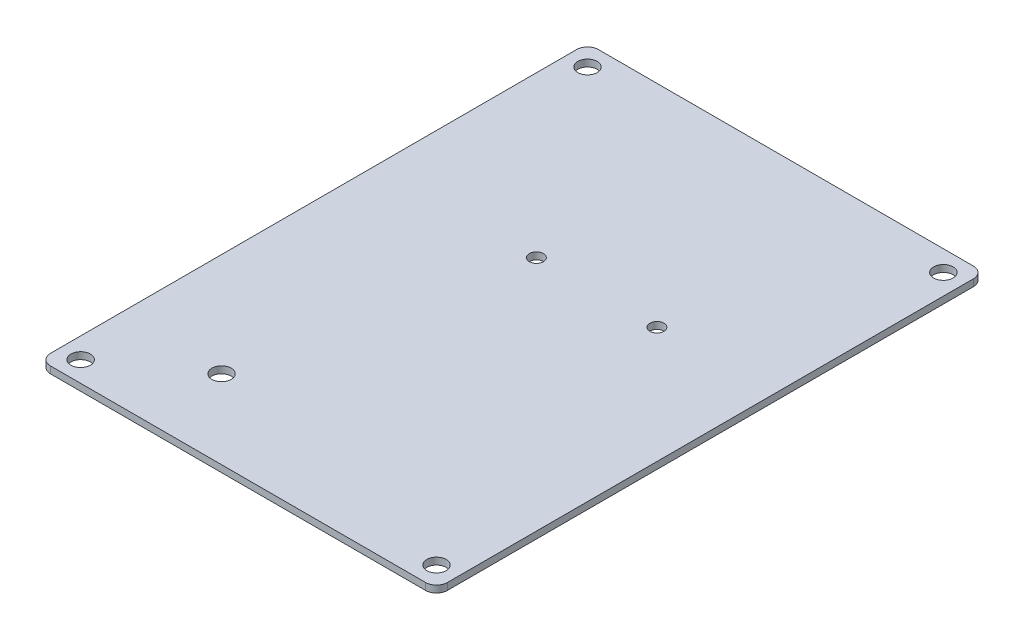
from build123d import *

# Parameters (mm, degrees)
SKETCH1_W                 = 92
SKETCH1_H                 = 127
BOSS_EXTRUDE1_DEPTH       = 1.6
M4_CLEARANCE_HOLE1_D      = 4.5
M4_CLEARANCE_HOLE1_DEPTH  = 50
M4_CLEARANCE_HOLE1_TIP    = 1.351936393
FILLET1_R                 = 2.54
F_4_CLEARANCE_HOLE1_D     = 3.2639
F_4_CLEARANCE_HOLE1_DEPTH = 18.75
F_4_CLEARANCE_HOLE1_TIP   = 0.980574487
F_8_CLEARANCE_HOLE1_D     = 4.4958
F_8_CLEARANCE_HOLE1_DEPTH = 18.75
F_8_CLEARANCE_HOLE1_TIP   = 1.350674586


with BuildPart() as part:
    # Sketch1 → Boss-Extrude1 (new body)
    with BuildSketch(Plane(origin=(0, 0, 0), x_dir=(1, 0, 0), z_dir=(0, 1, 0))):
        Rectangle(SKETCH1_W, SKETCH1_H)
    extrude(amount=BOSS_EXTRUDE1_DEPTH)

    # M4 Clearance Hole1
    with Locations(Plane(origin=(0, 1.6, 0), x_dir=(1, 0, 0), z_dir=(0, 1, 0))):
        with Locations((-41.2375, 58.7375), (41.2375, 58.7375), (41.2375, -58.7375), (-41.2375, -58.7375)):
            Hole(M4_CLEARANCE_HOLE1_D / 2, depth=M4_CLEARANCE_HOLE1_DEPTH)
            with Locations((0, 0, -(M4_CLEARANCE_HOLE1_DEPTH + M4_CLEARANCE_HOLE1_TIP / 2))):  # 118° drill point
                Cone(0, M4_CLEARANCE_HOLE1_D / 2, M4_CLEARANCE_HOLE1_TIP, mode=Mode.SUBTRACT)

    # Fillet1
    fillet1_edges = [part.edges().sort_by_distance(p)[0] for p in [
        (46, 0.8, 63.5),
        (46, 0.8, -63.5),
        (-46, 0.8, -63.5),
        (-46, 0.8, 63.5),
    ]]
    fillet(fillet1_edges, radius=FILLET1_R)

    # #4 Clearance Hole1
    with Locations(Plane(origin=(0, 1.6, 0), x_dir=(1, 0, 0), z_dir=(0, 1, 0))):
        with Locations((19.05, 14.54), (-8.89, 14.54)):
            Hole(F_4_CLEARANCE_HOLE1_D / 2, depth=F_4_CLEARANCE_HOLE1_DEPTH)
            with Locations((0, 0, -(F_4_CLEARANCE_HOLE1_DEPTH + F_4_CLEARANCE_HOLE1_TIP / 2))):  # 118° drill point
                Cone(0, F_4_CLEARANCE_HOLE1_D / 2, F_4_CLEARANCE_HOLE1_TIP, mode=Mode.SUBTRACT)

    # #8 Clearance Hole1
    with Locations(Plane(origin=(0, 0, 0), x_dir=(-1, 0, 0), z_dir=(0, -1, 0))):
        with Locations((22.07, -45.25)):
            Hole(F_8_CLEARANCE_HOLE1_D / 2, depth=F_8_CLEARANCE_HOLE1_DEPTH)
            with Locations((0, 0, -(F_8_CLEARANCE_HOLE1_DEPTH + F_8_CLEARANCE_HOLE1_TIP / 2))):  # 118° drill point
                Cone(0, F_8_CLEARANCE_HOLE1_D / 2, F_8_CLEARANCE_HOLE1_TIP, mode=Mode.SUBTRACT)


solid = part.part
